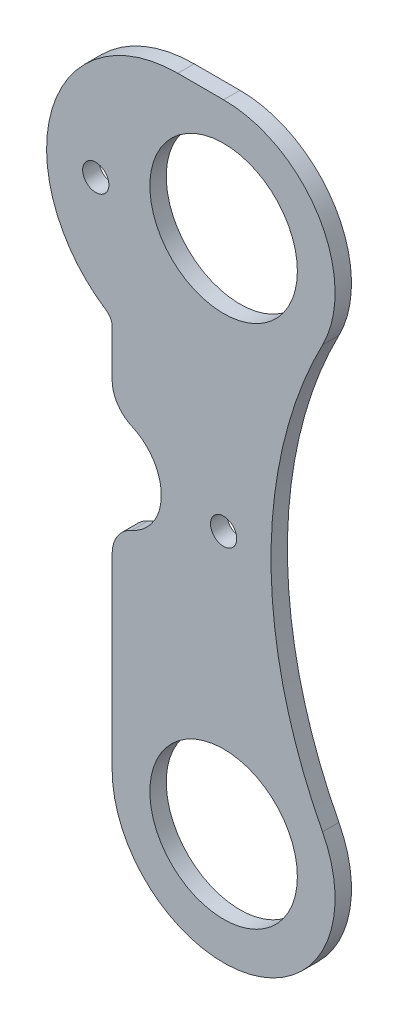
from build123d import *

# Parameters (mm, degrees)
SKETCH1_R           = 14.2875
SKETCH1_R_2         = 2.54
BOSS_EXTRUDE1_DEPTH = 3.175
CUT_EXTRUDE1_DEPTH  = 162.674043733
FILLET3_R           = 6.35
SKETCH3_R           = 2.54
BOSS_EXTRUDE3_DEPTH = 3.175
SKETCH6_R           = 2.54
BOSS_EXTRUDE4_DEPTH = 3.175
FILLET2_R           = 6.35
CUT_EXTRUDE2_DEPTH  = 169.237022961
CUT_EXTRUDE3_DEPTH  = 169.237022961
CUT_EXTRUDE4_DEPTH  = 168.265702461
SKETCH15_R          = 2.54
BOSS_EXTRUDE8_DEPTH = 3.175
FILLET4_R           = 2.54


with BuildPart() as part:
    # Sketch1 → Boss-Extrude1 (new body)
    with BuildSketch(Plane.XY):
        with BuildLine():
            Line((-8.89, 25.4), (8.89, 25.4))
            ThreePointArc((8.89, 25.4), (17.870256121, 21.680256121), (21.59, 12.7))
            Line((21.59, 12.7), (21.59, -117.775079775))
            ThreePointArc((21.59, -117.775079775), (21.127743647, -120.388718212), (19.797058824, -122.685251408))
            Line((19.797058824, -122.685251408), (-7.952696208, -155.616779465))
            ThreePointArc((-7.952696208, -155.616779465), (-12.268297602, -157.851943494), (-16.900388255, -156.380852124))
            Line((-16.900388255, -156.380852124), (-32.439211784, -143.287061102))
            ThreePointArc((-32.439211784, -143.287061102), (-34.674375812, -138.971459708), (-33.203284443, -134.339369055))
            Line((-33.203284443, -134.339369055), (-23.382941176, -122.685251408))
            ThreePointArc((-23.382941176, -122.685251408), (-22.052256353, -120.388718212), (-21.59, -117.775079775))
            Line((-21.59, -117.775079775), (-21.59, 12.7))
            ThreePointArc((-21.59, 12.7), (-17.870256121, 21.680256121), (-8.89, 25.4))
        make_face()
        Circle(SKETCH1_R, mode=Mode.SUBTRACT)
        with Locations((0, -101.6)):
            Circle(SKETCH1_R, mode=Mode.SUBTRACT)
        with Locations((-18.532085478, -142.550133084)):
            Circle(SKETCH1_R_2, mode=Mode.SUBTRACT)
        with Locations((0, -50.8)):
            Circle(SKETCH1_R_2, mode=Mode.SUBTRACT)
    extrude(amount=BOSS_EXTRUDE1_DEPTH)

    # Sketch2 → Cut-Extrude1 (cut, through all)
    with BuildSketch(Plane.XY):
        with BuildLine():
            ThreePointArc((-21.59, -60.325), (-12.065, -50.8), (-21.59, -41.275))
            Line((-21.59, -41.275), (-21.59, -60.325))
        make_face()
        with BuildLine():
            ThreePointArc((19.159083004, -91.647229609), (21.458203844, -103.981929422), (16.51, -115.512152961))
            Line((16.51, -115.512152961), (-17.501317584, -155.874478972))
            Line((-17.501317584, -155.874478972), (-7.620284479, -163.8572221))
            Line((-7.620284479, -163.8572221), (27.94, -121.656687185))
            Line((27.94, -121.656687185), (27.94, 0))
            Line((27.94, 0), (21.59, 0))
            ThreePointArc((21.59, 0), (20.973467787, -5.122670102), (19.159083004, -9.952770391))
            ThreePointArc((19.159083004, -9.952770391), (9.182340769, -50.8), (19.159083004, -91.647229609))
        make_face()
    extrude(amount=CUT_EXTRUDE1_DEPTH, mode=Mode.SUBTRACT)


with BuildPart() as cut_extrude1_piece_1:
    # of the separate pieces the step leaves, piece 1, a body of its own (cut_extrude1_pieces)
    add(part.part.solids().sort_by_distance((-8.89, 25.4, 0))[0])

    # Fillet3
    fillet3_edges = [cut_extrude1_piece_1.edges().sort_by_distance(p)[0] for p in [
        (-21.59, -41.275, 1.5875),
        (-21.59, -60.325, 1.5875),
    ]]
    fillet(fillet3_edges, radius=FILLET3_R)

    # Sketch3 → Boss-Extrude3 (add)
    with BuildSketch(Plane.XY.offset(3.175)):
        with BuildLine():
            Line((-27.351416194, -127.394768527), (-36.025496499, -137.688579))
            ThreePointArc((-36.025496499, -137.688579), (-37.217489152, -141.441859142), (-35.4063854, -144.93869507))
            Line((-35.4063854, -144.93869507), (-24.403104784, -154.210610454))
            ThreePointArc((-24.403104784, -154.210610454), (-19.771014132, -155.681701823), (-15.455412737, -153.446537795))
            Line((-15.455412737, -153.446537795), (-7.557639641, -144.073996091))
            Line((-7.557639641, -144.073996091), (-27.351416194, -127.394768527))
        make_face()
        with Locations((-18.532085478, -142.550133084)):
            Circle(SKETCH3_R, mode=Mode.SUBTRACT)
    extrude(amount=-BOSS_EXTRUDE3_DEPTH)

    # Sketch6 → Boss-Extrude4 (add)
    with BuildSketch(Plane.XY.offset(3.175)):
        Polygon((-35.4063854, -144.93869507), (-63.620410749, -121.164144113), (-51.344981666, -106.596497054), (-27.065569901, -127.055545526), align=None)
        with Locations((-52.626813855, -117.972130278)):
            Circle(SKETCH6_R, mode=Mode.SUBTRACT)
    extrude(amount=-BOSS_EXTRUDE4_DEPTH)

    # Fillet2
    fillet2_edges = [cut_extrude1_piece_1.edges().sort_by_distance(p)[0] for p in [
        (-63.620410749, -121.164144113, 1.5875),
        (-51.344981666, -106.596497054, 1.5875),
        (-27.065569901, -127.055545526, 1.5875),
    ]]
    fillet(fillet2_edges, radius=FILLET2_R)

    # Sketch7 → Cut-Extrude2 (cut, through all)
    with BuildSketch(Plane.XY.offset(3.175)):
        with BuildLine():
            Line((-21.59, 0), (-21.59, 31.75))
            Line((-21.59, 31.75), (21.59, 31.75))
            Line((21.59, 31.75), (21.59, 0))
            ThreePointArc((21.59, 0), (0, 21.59), (-21.59, 0))
        make_face()
    extrude(amount=-CUT_EXTRUDE2_DEPTH, mode=Mode.SUBTRACT)


with BuildPart() as cut_extrude1_piece_2:
    # of the separate pieces the step leaves, piece 2, a body of its own (cut_extrude1_pieces)
    add(part.part.solids().sort_by_distance((-16.900388255, -156.380852124, 0))[0])


with BuildPart() as cut_extrude3_tool:
    # Sketch10 → Cut-Extrude3 (new, through all)
    with BuildSketch(Plane.XY.offset(3.175)):
        with BuildLine():
            Line((-18.151882461, -155.32628042), (-17.361482582, -157.512020269))
            Line((-17.361482582, -157.512020269), (-14.375706423, -156.432313955))
            Line((-14.375706423, -156.432313955), (-15.455412737, -153.446537795))
            ThreePointArc((-15.455412737, -153.446537795), (-16.679911193, -154.563907595), (-18.151882461, -155.32628042))
        make_face()
    extrude(amount=-CUT_EXTRUDE3_DEPTH)


with BuildPart() as cut_extrude1_piece_1_1:
    add(cut_extrude1_piece_1.part)

    # Cut-Extrude3: cut by cut_extrude3_tool
    add(cut_extrude3_tool.part, mode=Mode.SUBTRACT)

    # Sketch12 → Cut-Extrude4 (cut, through all)
    with BuildSketch(Plane.XY.offset(3.175)):
        with BuildLine():
            Line((-21.59, -101.6), (-72.39, -101.6))
            Line((-72.39, -101.6), (-72.39, -165.1))
            Line((-72.39, -165.1), (16.51, -165.1))
            Line((16.51, -165.1), (16.51, -115.512152961))
            ThreePointArc((16.51, -115.512152961), (-7.405308906, -121.880273667), (-21.59, -101.6))
        make_face()
    extrude(amount=-CUT_EXTRUDE4_DEPTH, mode=Mode.SUBTRACT)

    # Sketch15 → Boss-Extrude8 (add)
    with BuildSketch(Plane.XY.offset(3.175)):
        with BuildLine():
            ThreePointArc((-34.29, -3.81), (-30.887045256, -16.51), (-21.59, -25.807045256))
            Line((-21.59, -25.807045256), (-21.59, 0))
            ThreePointArc((-21.59, 0), (-15.266435406, 15.266435406), (0, 21.59))
            Line((0, 21.59), (-8.89, 21.59))
            ThreePointArc((-8.89, 21.59), (-26.850512242, 14.150512242), (-34.29, -3.81))
        make_face()
        with Locations((-24.765, -3.81)):
            Circle(SKETCH15_R, mode=Mode.SUBTRACT)
    extrude(amount=-BOSS_EXTRUDE8_DEPTH)

    # Fillet4
    fillet4_edges = [cut_extrude1_piece_1_1.edges().sort_by_distance(p)[0] for p in [
        (-21.59, -25.807045256, 1.5875),
    ]]
    fillet(fillet4_edges, radius=FILLET4_R)


with BuildPart() as cut_extrude1_piece_2_1:
    add(cut_extrude1_piece_2.part)

    # Cut-Extrude3: cut by cut_extrude3_tool
    add(cut_extrude3_tool.part, mode=Mode.SUBTRACT)


solid = cut_extrude1_piece_1_1.part
